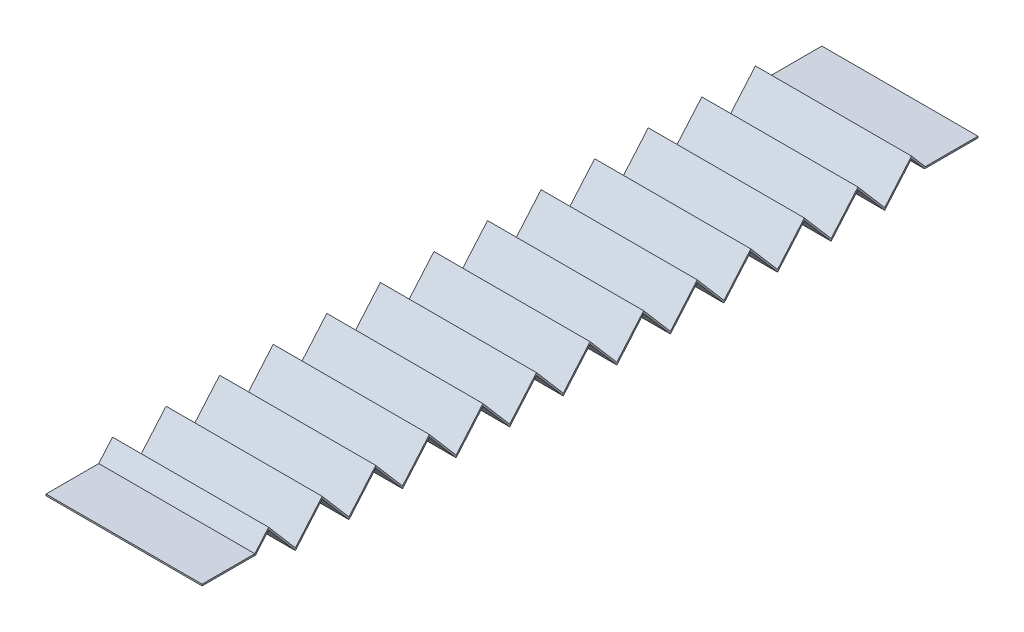
from build123d import *

# Parameters (mm, degrees)
EXTRUDE_THIN1_DEPTH = 25


with BuildPart() as part:
    # Sketch3 → Extrude-Thin1 (new, symmetric)
    with BuildSketch(Plane(origin=(0, 0, 0), x_dir=(0, 0, -1), z_dir=(1, 0, 0))):
        Polygon((0, 4.75), (17.114919694, 4.75), (21.289383497, 9.616041712), (29.868150491, -0.383958288), (38.446917485, 9.616041712), (47.025684479, -0.383958288), (55.604451474, 9.616041712), (64.183218468, -0.383958288), (72.761985462, 9.616041712), (81.340752456, -0.383958288), (89.91951945, 9.616041712), (98.498286444, -0.383958288), (107.077053438, 9.616041712), (115.655820432, -0.383958288), (124.234587427, 9.616041712), (132.813354421, -0.383958288), (141.392121415, 9.616041712), (149.970888409, -0.383958288), (158.549655403, 9.616041712), (167.128422397, -0.383958288), (175.707189391, 9.616041712), (184.285956385, -0.383958288), (192.864723379, 9.616041712), (201.443490374, -0.383958288), (210.022257368, 9.616041712), (218.601024362, -0.383958288), (227.179791356, 9.616041712), (231.354255159, 4.75), (248.469174853, 4.75), (248.469174853, 5.25), (231.584094547, 5.25), (227.179791356, 10.383958288), (218.601024362, 0.383958288), (210.022257368, 10.383958288), (201.443490374, 0.383958288), (192.864723379, 10.383958288), (184.285956385, 0.383958288), (175.707189391, 10.383958288), (167.128422397, 0.383958288), (158.549655403, 10.383958288), (149.970888409, 0.383958288), (141.392121415, 10.383958288), (132.813354421, 0.383958288), (124.234587427, 10.383958288), (115.655820432, 0.383958288), (107.077053438, 10.383958288), (98.498286444, 0.383958288), (89.91951945, 10.383958288), (81.340752456, 0.383958288), (72.761985462, 10.383958288), (64.183218468, 0.383958288), (55.604451474, 10.383958288), (47.025684479, 0.383958288), (38.446917485, 10.383958288), (29.868150491, 0.383958288), (21.289383497, 10.383958288), (16.885080306, 5.25), (0, 5.25), align=None)
    extrude(amount=EXTRUDE_THIN1_DEPTH, both=True)


solid = part.part
